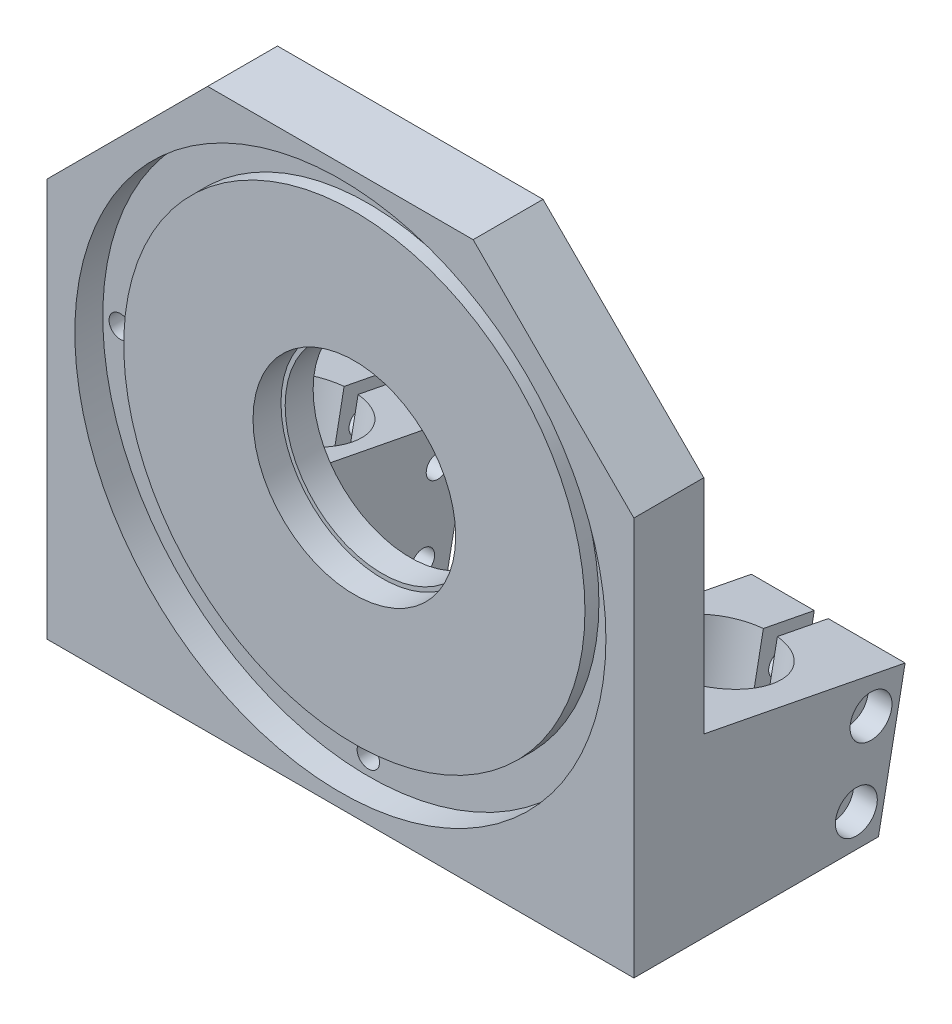
from build123d import *

# Parameters (mm, degrees)
SKETCH_1_W                  = 84
SKETCH_1_H                  = 80
SKETCH_1_R                  = 13.9
EXTRUDE_1_DEPTH             = 5
EXTRUDE_2_DEPTH             = 22
CUT_EXTRUDE_3_REACH         = 79
HOLE_START                  = -42
HOLE_WIZARD_2_OUTLINE_R     = 1.7
HOLE_WIZARD_2_DEPTH         = 11
HOLE_WIZARD_2_2_OUTLINE_R   = 3
HOLE_WIZARD_2_2_OUTLINE_R_2 = 1.7
HOLE_WIZARD_2_2_DEPTH       = 3.4
HOLE_WIZARD_M4_2_D          = 3.3
SKETCH_14_R                 = 38
SKETCH_14_R_2               = 33
CUT_EXTRUDE_4_DEPTH         = 4
HOLE_WIZARD_3_D             = 3.2
HOLE_WIZARD_3_CBORE_D       = 6
HOLE_WIZARD_3_CBORE_DEPTH   = 3.4
CHAMFER_1_SIZE              = 23
SKETCH_17_R                 = 14.5
CUT_EXTRUDE_5_DEPTH         = 6
SKETCH_18_R                 = 33
CUT_EXTRUDE_6_DEPTH         = 2


# Read off the part's stored shape, not the designer's step: 打孔尺寸(%根据)内六角圆柱头螺钉的类型2
with BuildPart() as part:
    # 草图1 → 凸台-拉伸1 (new, symmetric)
    with BuildSketch(Plane.XY):
        Rectangle(SKETCH_1_W, SKETCH_1_H)
        Circle(SKETCH_1_R, mode=Mode.SUBTRACT)
    extrude(amount=EXTRUDE_1_DEPTH, both=True)

    # 草图6 → 凸台-拉伸2 (add)
    with BuildSketch(Plane.ZY.offset(42)):
        Polygon((-5, -14.766158372), (-5, -40), (-30, -40), (-33.816179908, -20.367456331), align=None)
    extrude_2 = extrude(amount=-EXTRUDE_2_DEPTH)

    # 切除-拉伸3: up to this plane
    cut_extrude_3_end = Plane(origin=(-42, -40, 5), z_dir=(0, 1, 0))
    # 草图7 → 切除-拉伸3 (cut, up to the surface)
    with BuildSketch(Plane(origin=(0, -13.292034521, 2.583709779), x_dir=(1, 0, 0), z_dir=(0, 0.9816271834476648, -0.19080899537654153)), mode=Mode.PRIVATE) as cut_extrude_3_sk1:
        with BuildLine():
            Line((-31, 37.081175318), (-29, 37.081175318))
            Line((-29, 37.081175318), (-29, 29.662905695))
            ThreePointArc((-29, 29.662905695), (-30, 13.725651762), (-31, 29.662905695))
            Line((-31, 29.662905695), (-31, 37.081175318))
        make_face()
    cut_extrude_3_tool1 = split(extrude(cut_extrude_3_sk1.sketch, amount=-CUT_EXTRUDE_3_REACH, mode=Mode.PRIVATE), bisect_by=cut_extrude_3_end, keep=Keep.BOTH, mode=Mode.PRIVATE)
    cut_extrude_3 = cut_extrude_3_tool1.solids().sort_by_distance((-30, -17.589666, -19.525688))[0]
    add(cut_extrude_3, mode=Mode.SUBTRACT)

    # 打孔尺寸(%根据)内六角圆柱头螺钉的类型2 outline → 打孔尺寸(%根据)内六角圆柱头螺钉的类型2 (cut)
    with BuildSketch(Plane.YZ.offset(HOLE_START)):
        with Locations((-35.310255285, -26.836727248)):
            Circle(HOLE_WIZARD_2_OUTLINE_R)
        with Locations((-24.512356267, -28.935626197)):
            Circle(HOLE_WIZARD_2_OUTLINE_R)
    hole_wizard_2 = extrude(amount=HOLE_WIZARD_2_DEPTH, mode=Mode.SUBTRACT)

    # Hole Wizard 2 2 outline → Hole Wizard 2 2 (cut)
    # profile 1 of 2: a face of its own
    with BuildSketch(Plane.YZ.offset(HOLE_START)):
        with Locations((-35.310255285, -26.836727248)):
            Circle(HOLE_WIZARD_2_2_OUTLINE_R)
        with Locations((-35.310255285, -26.836727248)):
            Circle(HOLE_WIZARD_2_2_OUTLINE_R_2, mode=Mode.SUBTRACT)
    # profile 2 of 2: a face of its own
    with BuildSketch(Plane.YZ.offset(HOLE_START)):
        with Locations((-24.512356267, -28.935626197)):
            Circle(HOLE_WIZARD_2_2_OUTLINE_R)
        with Locations((-24.512356267, -28.935626197)):
            Circle(HOLE_WIZARD_2_2_OUTLINE_R_2, mode=Mode.SUBTRACT)
    hole_wizard_2_2 = extrude(amount=HOLE_WIZARD_2_2_DEPTH, mode=Mode.SUBTRACT)

    # M4 螺纹孔2 (through all)
    with Locations(Plane(origin=(-20, 0, 0), x_dir=(0, 0, -1), z_dir=(1, 0, 0))):
        with Locations((28.935626197, -24.512356267), (26.836727248, -35.310255285)):
            hole_wizard_m4_2 = Hole(HOLE_WIZARD_M4_2_D / 2)

    # 草图14 → 切除-拉伸4 (cut)
    with BuildSketch(Plane.XY.offset(5)):
        Circle(SKETCH_14_R)
        Circle(SKETCH_14_R_2, mode=Mode.SUBTRACT)
    extrude(amount=-CUT_EXTRUDE_4_DEPTH, mode=Mode.SUBTRACT)

    # 镜向1: 凸台-拉伸2, 切除-拉伸3, 打孔尺寸(%根据)内六角圆柱头螺钉的类型2, Hole Wizard 2 2, M4 螺纹孔2 across plane
    add(extrude_2.mirror(Plane(origin=(0, 0, 0), x_dir=(0, 0, 1), z_dir=(1, 0, 0))))
    add(cut_extrude_3.mirror(Plane(origin=(0, 0, 0), x_dir=(0, 0, 1), z_dir=(1, 0, 0))), mode=Mode.SUBTRACT)
    add(hole_wizard_2.mirror(Plane(origin=(0, 0, 0), x_dir=(0, 0, 1), z_dir=(1, 0, 0))), mode=Mode.SUBTRACT)
    add(hole_wizard_2_2.mirror(Plane(origin=(0, 0, 0), x_dir=(0, 0, 1), z_dir=(1, 0, 0))), mode=Mode.SUBTRACT)
    add(hole_wizard_m4_2.mirror(Plane(origin=(0, 0, 0), x_dir=(0, 0, 1), z_dir=(1, 0, 0))), mode=Mode.SUBTRACT)

    # 打孔尺寸(%根据)内六角圆柱头螺钉的类型3 (through all)
    with Locations(Plane(origin=(0, 0, -5), x_dir=(-1, 0, 0), z_dir=(0, 0, -1))):
        with Locations((0, 35.5), (35.5, 0), (0, -35.5), (-35.5, 0)):
            CounterBoreHole(HOLE_WIZARD_3_D / 2, HOLE_WIZARD_3_CBORE_D / 2, HOLE_WIZARD_3_CBORE_DEPTH)

    # 倒角1
    chamfer_1_edges = [part.edges().sort_by_distance(p)[0] for p in [
        (42, 40, 0),
        (-42, 40, 0),
    ]]
    chamfer(chamfer_1_edges, length=CHAMFER_1_SIZE)

    # 草图17 → 切除-拉伸5 (cut)
    with BuildSketch(Plane.XY.offset(5)):
        Circle(SKETCH_17_R)
    extrude(amount=-CUT_EXTRUDE_5_DEPTH, mode=Mode.SUBTRACT)

    # 草图18 → 切除-拉伸6 (cut)
    with BuildSketch(Plane.XY.offset(5)):
        Circle(SKETCH_18_R)
    extrude(amount=-CUT_EXTRUDE_6_DEPTH, mode=Mode.SUBTRACT)


solid = part.part
